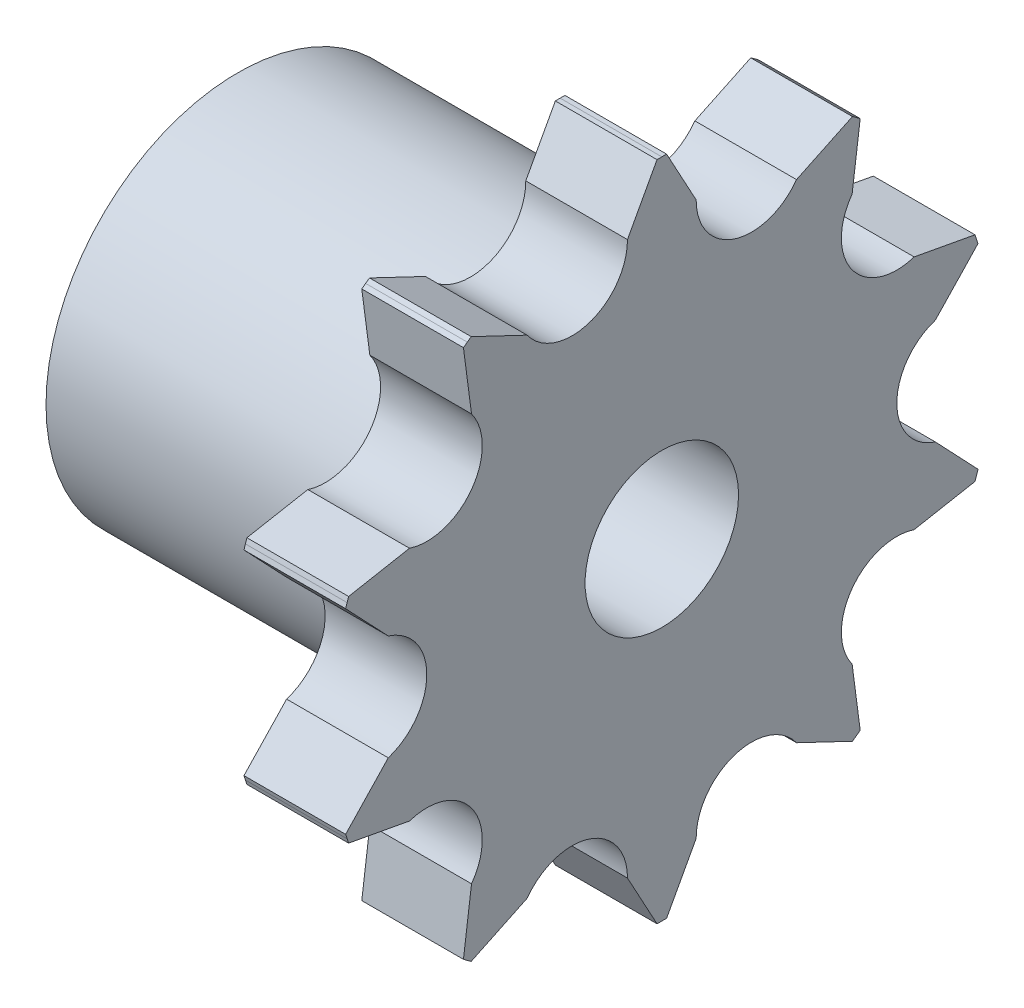
from build123d import *

# Parameters (mm, degrees)
BOSS_EXTRUDE1_DEPTH = 5.3
CIRPATTERN2_COUNT   = 10
SKETCH2_R           = 10
SKETCH2_R_2         = 4
BOSS_EXTRUDE2_DEPTH = 16.8
CUT_EXTRUDE1_START  = -16.8
SKETCH2_2_R         = 4
CUT_EXTRUDE1_DEPTH  = 16.8


with BuildPart() as part:
    # Sketch1 → Boss-Extrude1 (new body)
    with BuildSketch(Plane(origin=(0, 0, 0), x_dir=(0, 0, -1), z_dir=(1, 0, 0))):
        with BuildLine():
            Line((0, 0), (10.139295602, 13.955543153))
            Line((10.139295602, 13.955543153), (9.935981835, 14.101019997))
            Line((9.935981835, 14.101019997), (7.021724675, 12.711459495))
            ThreePointArc((7.021724675, 12.711459495), (3.785458181, 11.650442325), (1.790913835, 14.411052964))
            Line((1.790913835, 14.411052964), (0.249993436, 17.248188406))
            ThreePointArc((0.249993436, 17.248188406), (0.125, 17.249547096), (0, 17.25))
            Line((0, 17.25), (0, 0))
        make_face()
    boss_extrude1 = extrude(amount=BOSS_EXTRUDE1_DEPTH)

    # CirPattern2: Boss-Extrude1 ×10 about axis
    cirpattern2_axis = Axis((5.3, 0, 0), (-1, 0, 0))
    for i in range(1, CIRPATTERN2_COUNT):
        add(boss_extrude1.rotate(cirpattern2_axis, i * 360 / CIRPATTERN2_COUNT))

    # Sketch2 → Boss-Extrude2 (add)
    with BuildSketch(Plane.ZY):
        Circle(SKETCH2_R)
        Circle(SKETCH2_R_2, mode=Mode.SUBTRACT)
    extrude(amount=BOSS_EXTRUDE2_DEPTH)

    # Sketch2<2> → Cut-Extrude1 (cut)
    with BuildSketch(Plane.ZY.offset(CUT_EXTRUDE1_START)):
        Circle(SKETCH2_2_R)
    extrude(amount=CUT_EXTRUDE1_DEPTH, mode=Mode.SUBTRACT)


solid = part.part
